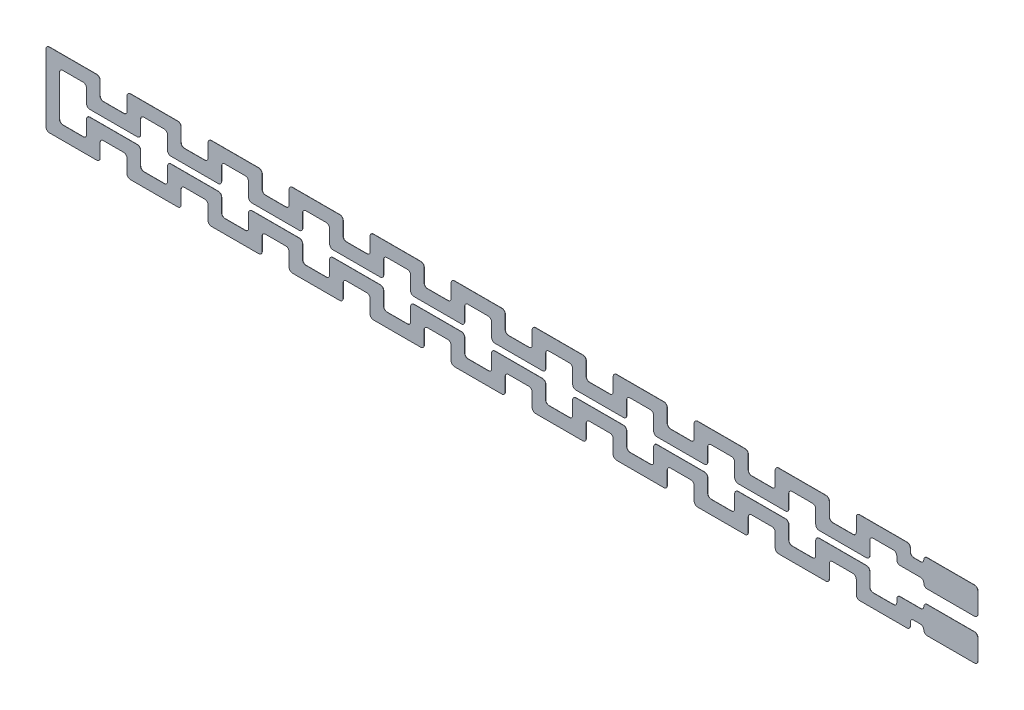
from build123d import *

# Parameters (mm, degrees)
SKETCH1_W               = 4
SKETCH1_H               = 2
BOSS_EXTRUDE2_DEPTH     = 0.015
BOSS_EXTRUDE2_2_DEPTH   = 0.015
BOSS_EXTRUDE4_DEPTH     = 0.015
BOSS_EXTRUDE29_DEPTH    = 0.015
FILLET8_R               = 0.25
LPATTERN5_COUNT         = 10
LPATTERN5_PITCH         = 6
FILLET8_OF_LPATTERN5_R  = 0.25
FILLET9_R               = 0.25
FILLET10_R              = 0.25
BOSS_EXTRUDE30_DEPTH    = 0.015
FILLET11_R              = 0.25
BOSS_EXTRUDE31_DEPTH    = 0.015
FILLET12_R              = 0.25
LPATTERN6_COUNT         = 10
LPATTERN6_PITCH         = 6
FILLET12_OF_LPATTERN6_R = 0.25
CUT_EXTRUDE2_DEPTH      = 71.053998637
BOSS_EXTRUDE32_DEPTH    = 0.015


with BuildPart() as part:
    # Sketch1 → Boss-Extrude2 (new body)
    with BuildSketch(Plane.XY):
        with Locations((0, 1.5)):
            Rectangle(SKETCH1_W, SKETCH1_H)
    extrude(amount=BOSS_EXTRUDE2_DEPTH)

    # Sketch27 → Boss-Extrude30 (add)
    with BuildSketch(Plane(origin=(0, 0, 0), x_dir=(-1, 0, 0), z_dir=(0, 0, -1))):
        Polygon((3, 2), (2, 2), (2, 1), (4, 1), (4, 1.75), (6, 1.75), (6, 0.25), (10, 0.25), (10, 1.5), (9, 1.5), (9, 1.25), (7, 1.25), (7, 2.75), (3, 2.75), align=None)
    extrude(amount=-BOSS_EXTRUDE30_DEPTH)

    # Fillet11
    fillet11_edges = [part.edges().sort_by_distance(p)[0] for p in [
        (-9, 1.25, 0.0075),
        (-10, 0.25, 0.0075),
        (-3, 2, 0.0075),
        (2, 2.5, 0.0075),
        (2, 0.5, 0.0075),
        (-4, 1.75, 0.0075),
        (-2, 1, 0.0075),
        (-6, 0.25, 0.0075),
        (-6, 1.75, 0.0075),
        (-7, 1.25, 0.0075),
        (-7, 2.75, 0.0075),
        (-3, 2.75, 0.0075),
        (-2, 2.5, 0.0075),
        (-2, 2, 0.0075),
        (-2, 0.5, 0.0075),
        (-4, 1, 0.0075),
    ]]
    fillet(fillet11_edges, radius=FILLET11_R - 0.0001)  # a hair under: the kernel refuses the full size

    # Sketch28 → Boss-Extrude31 (add)
    with BuildSketch(Plane(origin=(0, 0, 0), x_dir=(-1, 0, 0), z_dir=(0, 0, -1))):
        Polygon((15, 1.5), (16, 1.5), (16, 0.25), (12, 0.25), (12, 1.75), (10, 1.75), (10, 1.5), (9, 1.5), (9, 2.75), (13, 2.75), (13, 1.25), (15, 1.25), align=None)
    boss_extrude31 = extrude(amount=-BOSS_EXTRUDE31_DEPTH)

    # Fillet12
    fillet12_edges = [part.edges().sort_by_distance(p)[0] for p in [
        (-10, 1.75, 0.0075),
        (-12, 1.75, 0.0075),
        (-13, 1.25, 0.0075),
        (-15, 1.25, 0.0075),
    ]]
    fillet(fillet12_edges, radius=FILLET12_R - 0.0001)  # a hair under: the kernel refuses the full size
    fillet12_2_edges = [part.edges().sort_by_distance(p)[0] for p in [
        (-16, 0.25, 0.0075),
        (-13, 2.75, 0.0075),
        (-12, 0.25, 0.0075),
        (-9, 2.75, 0.0075),
    ]]
    fillet(fillet12_2_edges, radius=FILLET12_R)

    # LPattern6: Boss-Extrude31 ×10
    with Locations(*[(-i * LPATTERN6_PITCH, 0, 0) for i in range(1, LPATTERN6_COUNT)]):
        add(boss_extrude31)

    # Fillet12 of LPattern6
    fillet12_of_lpattern6_edges = [part.edges().sort_by_distance(p)[0] for p in [
        (-16, 1.75, 0.0075),
        (-18, 1.75, 0.0075),
        (-19, 1.25, 0.0075),
        (-21, 1.25, 0.0075),
        (-22, 1.75, 0.0075),
        (-24, 1.75, 0.0075),
        (-25, 1.25, 0.0075),
        (-27, 1.25, 0.0075),
        (-28, 1.75, 0.0075),
        (-30, 1.75, 0.0075),
        (-31, 1.25, 0.0075),
        (-33, 1.25, 0.0075),
        (-34, 1.75, 0.0075),
        (-36, 1.75, 0.0075),
        (-37, 1.25, 0.0075),
        (-39, 1.25, 0.0075),
        (-40, 1.75, 0.0075),
        (-42, 1.75, 0.0075),
        (-43, 1.25, 0.0075),
        (-45, 1.25, 0.0075),
        (-46, 1.75, 0.0075),
        (-48, 1.75, 0.0075),
        (-49, 1.25, 0.0075),
        (-51, 1.25, 0.0075),
        (-52, 1.75, 0.0075),
        (-54, 1.75, 0.0075),
        (-55, 1.25, 0.0075),
        (-57, 1.25, 0.0075),
        (-58, 1.75, 0.0075),
        (-60, 1.75, 0.0075),
        (-61, 1.25, 0.0075),
        (-63, 1.25, 0.0075),
        (-64, 1.75, 0.0075),
        (-66, 1.75, 0.0075),
        (-67, 1.25, 0.0075),
        (-69, 1.25, 0.0075),
    ]]
    fillet(fillet12_of_lpattern6_edges, radius=FILLET12_OF_LPATTERN6_R - 0.0001)  # a hair under: the kernel refuses the full size
    fillet12_of_lpattern6_2_edges = [part.edges().sort_by_distance(p)[0] for p in [
        (-22, 0.25, 0.0075),
        (-19, 2.75, 0.0075),
        (-18, 0.25, 0.0075),
        (-15, 2.75, 0.0075),
        (-28, 0.25, 0.0075),
        (-25, 2.75, 0.0075),
        (-24, 0.25, 0.0075),
        (-21, 2.75, 0.0075),
        (-34, 0.25, 0.0075),
        (-31, 2.75, 0.0075),
        (-30, 0.25, 0.0075),
        (-27, 2.75, 0.0075),
        (-40, 0.25, 0.0075),
        (-37, 2.75, 0.0075),
        (-36, 0.25, 0.0075),
        (-33, 2.75, 0.0075),
        (-46, 0.25, 0.0075),
        (-43, 2.75, 0.0075),
        (-42, 0.25, 0.0075),
        (-39, 2.75, 0.0075),
        (-52, 0.25, 0.0075),
        (-49, 2.75, 0.0075),
        (-48, 0.25, 0.0075),
        (-45, 2.75, 0.0075),
        (-58, 0.25, 0.0075),
        (-55, 2.75, 0.0075),
        (-54, 0.25, 0.0075),
        (-51, 2.75, 0.0075),
        (-64, 0.25, 0.0075),
        (-61, 2.75, 0.0075),
        (-60, 0.25, 0.0075),
        (-57, 2.75, 0.0075),
        (-70, 0.25, 0.0075),
        (-67, 2.75, 0.0075),
        (-66, 0.25, 0.0075),
        (-63, 2.75, 0.0075),
    ]]
    fillet(fillet12_of_lpattern6_2_edges, radius=FILLET12_OF_LPATTERN6_R)


with BuildPart() as body_2:
    # Sketch1 → Boss-Extrude2 2 (new body)
    with BuildSketch(Plane.XY):
        with Locations((0, -1.5)):
            Rectangle(SKETCH1_W, SKETCH1_H)
    extrude(amount=BOSS_EXTRUDE2_2_DEPTH)

    # Sketch4 → Boss-Extrude4 (add)
    with BuildSketch(Plane.XY):
        Polygon((-2, -2), (-2, -1), (-4, -1), (-4, -1.75), (-6, -1.75), (-6, -0.25), (-10, -0.25), (-10, -1.5), (-9, -1.5), (-9, -1.25), (-7, -1.25), (-7, -2.75), (-3, -2.75), (-3, -2), align=None)
    extrude(amount=BOSS_EXTRUDE4_DEPTH)

    # Sketch26 → Boss-Extrude29 (add)
    with BuildSketch(Plane(origin=(0, 0, 0), x_dir=(-1, 0, 0), z_dir=(0, 0, -1))):
        Polygon((15, -1.25), (15, -1.5), (16, -1.5), (16, -0.25), (12, -0.25), (12, -1.75), (10, -1.75), (10, -1.5), (9, -1.5), (9, -2.75), (13, -2.75), (13, -1.25), align=None)
    boss_extrude29 = extrude(amount=-BOSS_EXTRUDE29_DEPTH)

    # Fillet8
    fillet8_edges = [body_2.edges().sort_by_distance(p)[0] for p in [
        (-15, -1.25, 0.0075),
        (-12, -1.75, 0.0075),
        (-10, -1.75, 0.0075),
        (-13, -1.25, 0.0075),
    ]]
    fillet(fillet8_edges, radius=FILLET8_R - 0.0001)  # a hair under: the kernel refuses the full size
    fillet8_2_edges = [body_2.edges().sort_by_distance(p)[0] for p in [
        (-16, -0.25, 0.0075),
        (-12, -0.25, 0.0075),
        (-13, -2.75, 0.0075),
        (-9, -2.75, 0.0075),
    ]]
    fillet(fillet8_2_edges, radius=FILLET8_R)

    # LPattern5: Boss-Extrude29 ×10
    with Locations(*[(-i * LPATTERN5_PITCH, 0, 0) for i in range(1, LPATTERN5_COUNT)]):
        add(boss_extrude29)

    # Fillet8 of LPattern5
    fillet8_of_lpattern5_edges = [body_2.edges().sort_by_distance(p)[0] for p in [
        (-21, -1.25, 0.0075),
        (-18, -1.75, 0.0075),
        (-16, -1.75, 0.0075),
        (-19, -1.25, 0.0075),
        (-27, -1.25, 0.0075),
        (-24, -1.75, 0.0075),
        (-22, -1.75, 0.0075),
        (-25, -1.25, 0.0075),
        (-33, -1.25, 0.0075),
        (-30, -1.75, 0.0075),
        (-28, -1.75, 0.0075),
        (-31, -1.25, 0.0075),
        (-39, -1.25, 0.0075),
        (-36, -1.75, 0.0075),
        (-34, -1.75, 0.0075),
        (-37, -1.25, 0.0075),
        (-45, -1.25, 0.0075),
        (-42, -1.75, 0.0075),
        (-40, -1.75, 0.0075),
        (-43, -1.25, 0.0075),
        (-51, -1.25, 0.0075),
        (-48, -1.75, 0.0075),
        (-46, -1.75, 0.0075),
        (-49, -1.25, 0.0075),
        (-57, -1.25, 0.0075),
        (-54, -1.75, 0.0075),
        (-52, -1.75, 0.0075),
        (-55, -1.25, 0.0075),
        (-63, -1.25, 0.0075),
        (-60, -1.75, 0.0075),
        (-58, -1.75, 0.0075),
        (-61, -1.25, 0.0075),
        (-69, -1.25, 0.0075),
        (-66, -1.75, 0.0075),
        (-64, -1.75, 0.0075),
        (-67, -1.25, 0.0075),
    ]]
    fillet(fillet8_of_lpattern5_edges, radius=FILLET8_OF_LPATTERN5_R - 0.0001)  # a hair under: the kernel refuses the full size
    fillet8_of_lpattern5_2_edges = [body_2.edges().sort_by_distance(p)[0] for p in [
        (-22, -0.25, 0.0075),
        (-18, -0.25, 0.0075),
        (-19, -2.75, 0.0075),
        (-15, -2.75, 0.0075),
        (-28, -0.25, 0.0075),
        (-24, -0.25, 0.0075),
        (-25, -2.75, 0.0075),
        (-21, -2.75, 0.0075),
        (-34, -0.25, 0.0075),
        (-30, -0.25, 0.0075),
        (-31, -2.75, 0.0075),
        (-27, -2.75, 0.0075),
        (-40, -0.25, 0.0075),
        (-36, -0.25, 0.0075),
        (-37, -2.75, 0.0075),
        (-33, -2.75, 0.0075),
        (-46, -0.25, 0.0075),
        (-42, -0.25, 0.0075),
        (-43, -2.75, 0.0075),
        (-39, -2.75, 0.0075),
        (-52, -0.25, 0.0075),
        (-48, -0.25, 0.0075),
        (-49, -2.75, 0.0075),
        (-45, -2.75, 0.0075),
        (-58, -0.25, 0.0075),
        (-54, -0.25, 0.0075),
        (-55, -2.75, 0.0075),
        (-51, -2.75, 0.0075),
        (-64, -0.25, 0.0075),
        (-60, -0.25, 0.0075),
        (-61, -2.75, 0.0075),
        (-57, -2.75, 0.0075),
        (-70, -0.25, 0.0075),
        (-66, -0.25, 0.0075),
        (-67, -2.75, 0.0075),
        (-63, -2.75, 0.0075),
    ]]
    fillet(fillet8_of_lpattern5_2_edges, radius=FILLET8_OF_LPATTERN5_R)

    # Fillet9
    fillet9_edges = [body_2.edges().sort_by_distance(p)[0] for p in [
        (-9, -1.25, 0.0075),
        (-7, -1.25, 0.0075),
        (-7, -2.75, 0.0075),
        (-3, -2.75, 0.0075),
        (-3, -2, 0.0075),
        (-4, -1, 0.0075),
        (-4, -1.75, 0.0075),
        (-6, -1.75, 0.0075),
        (-6, -0.25, 0.0075),
        (-10, -0.25, 0.0075),
    ]]
    fillet(fillet9_edges, radius=FILLET9_R)

    # Fillet10
    fillet10_edges = [body_2.edges().sort_by_distance(p)[0] for p in [
        (2, -2.5, 0.0075),
        (-2, -2, 0.0075),
        (-2, -2.5, 0.0075),
        (2, -0.5, 0.0075),
        (-2, -0.5, 0.0075),
        (-2, -1, 0.0075),
    ]]
    fillet(fillet10_edges, radius=FILLET10_R - 0.0001)  # a hair under: the kernel refuses the full size


with BuildPart() as cut_extrude2_tool:
    # Sketch29 → Cut-Extrude2 (new, through all)
    with BuildSketch(Plane.XY.offset(0.015)):
        Polygon((-67, -1.5), (-67, -2.5), (-70.743545689, -2.5), (-70.743545689, 2.5), (-67, 2.5), (-67, 1.5), align=None)
    extrude(amount=-CUT_EXTRUDE2_DEPTH)


with BuildPart() as part_1:
    add(part.part)

    # Cut-Extrude2: cut by cut_extrude2_tool
    add(cut_extrude2_tool.part, mode=Mode.SUBTRACT)



with BuildPart() as body_2_1:
    add(body_2.part)

    # Cut-Extrude2: cut by cut_extrude2_tool
    add(cut_extrude2_tool.part, mode=Mode.SUBTRACT)


with BuildPart() as part_2:
    add(part_1.part)

    add(body_2_1.part)  # Boss-Extrude32 merges body 2
    # Sketch30 → Boss-Extrude32 (add)
    with BuildSketch(Plane.XY.offset(0.015)):
        Polygon((-66, -1.5), (-66, -0.5), (-66, 0.5), (-66, 1.5), (-67, 1.5), (-67, 0.25), (-67, -0.25), (-67, -1.5), align=None)
    extrude(amount=-BOSS_EXTRUDE32_DEPTH)


solid = part_2.part
